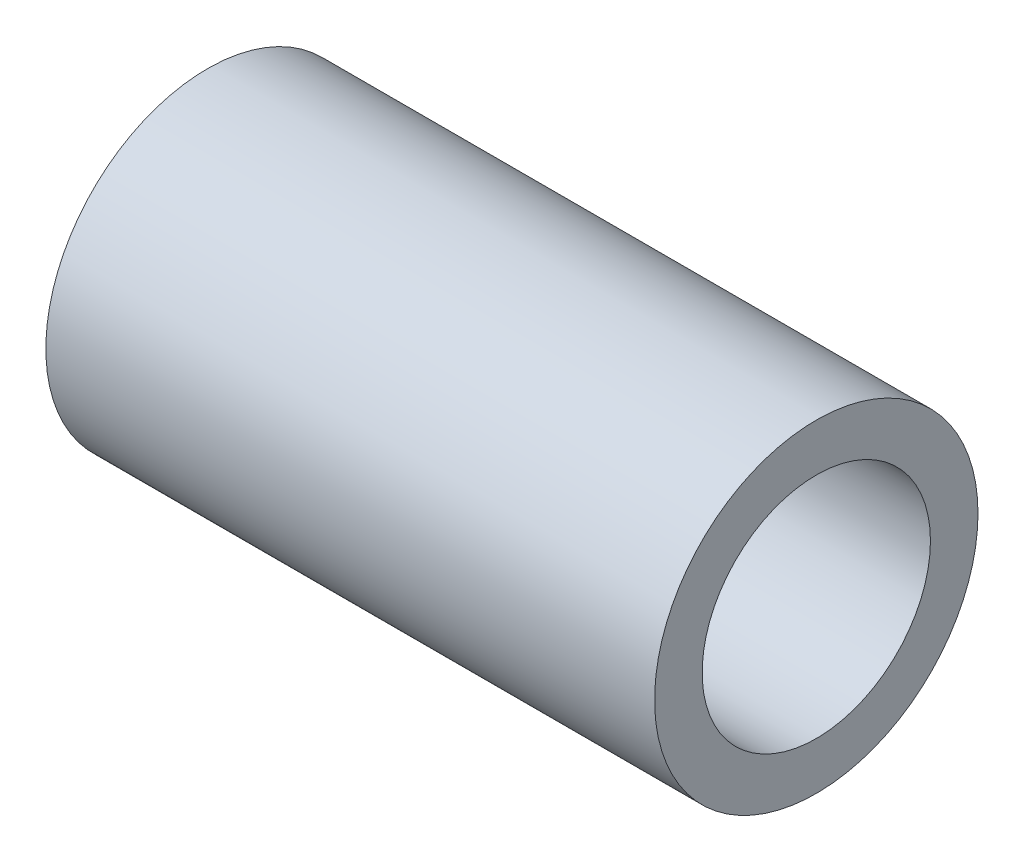
from build123d import *

# Parameters (mm, degrees)
SWEEP1_PROFILE_R     = 13.49375
CUT_SWEEP1_PROFILE_R = 9.525


with BuildPart() as part:
    # Sweep1: sweep along a path in Sketch1
    with BuildLine(Plane.XY) as sweep1_path:
        Line((0, 0), (50.8, 0))
    # Sweep1 profile (on start of the path) → Sweep1 (sweep)
    with BuildSketch(Plane(origin=(0, 0, 0), x_dir=(0, 0, 1), z_dir=(1, 0, 0))):
        Circle(SWEEP1_PROFILE_R)
    sweep(path=sweep1_path.line)

    # Cut-Sweep1: sweep along a path in Sketch1<3>
    with BuildLine(Plane.XY) as cut_sweep1_path:
        Line((0, 0), (50.8, 0))
    # Cut-Sweep1 profile (on start of the path) → Cut-Sweep1 (sweep, cut)
    with BuildSketch(Plane(origin=(0, 0, 0), x_dir=(0, 0, 1), z_dir=(1, 0, 0))):
        Circle(CUT_SWEEP1_PROFILE_R)
    sweep(path=cut_sweep1_path.line, mode=Mode.SUBTRACT)


solid = part.part
